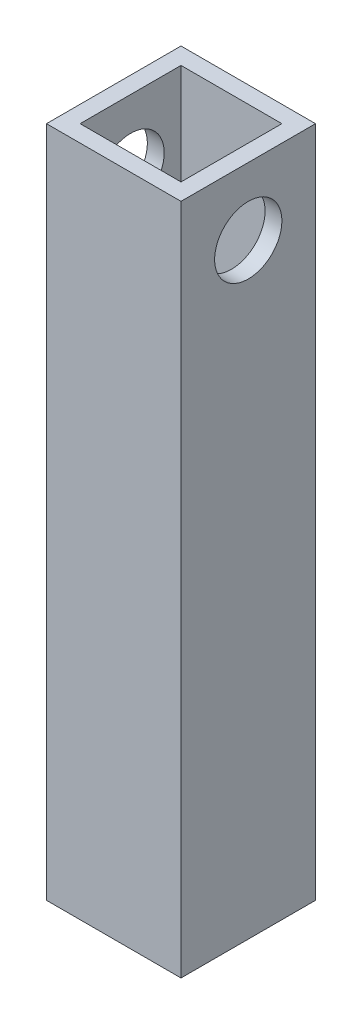
from build123d import *

# Parameters (mm, degrees)
SKETCH1_W           = 25.4
SKETCH1_H           = 25.4
SKETCH1_W_2         = 19.05
SKETCH1_H_2         = 19.05
EXTRUDE_THIN1_DEPTH = 127
SKETCH2_R           = 6.35
CUT_EXTRUDE1_DEPTH  = 131.136274728


with BuildPart() as part:
    # Sketch1 → Extrude-Thin1 (new body)
    with BuildSketch(Plane(origin=(0, 0, 0), x_dir=(1, 0, 0), z_dir=(0, 1, 0))):
        Rectangle(SKETCH1_W, SKETCH1_H)
        Rectangle(SKETCH1_W_2, SKETCH1_H_2, mode=Mode.SUBTRACT)
    extrude(amount=EXTRUDE_THIN1_DEPTH)

    # Sketch2 → Cut-Extrude1 (cut, through all)
    with BuildSketch(Plane(origin=(12.7, 0, 0), x_dir=(0, 0, -1), z_dir=(1, 0, 0))):
        with Locations((0, 114.3)):
            Circle(SKETCH2_R)
    extrude(amount=-CUT_EXTRUDE1_DEPTH, mode=Mode.SUBTRACT)


solid = part.part
